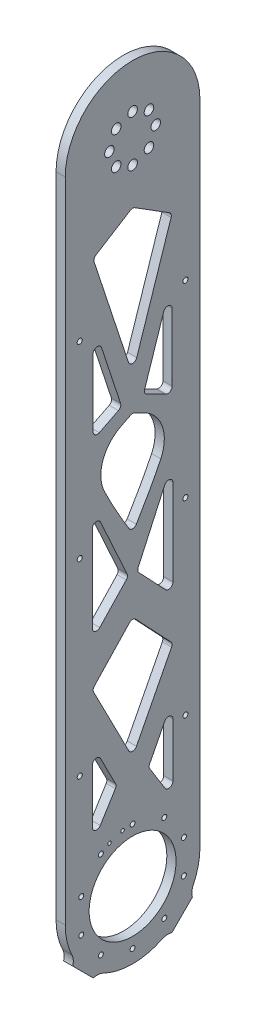
from build123d import *

# Parameters (mm, degrees)
SKETCH1_R                            = 3.3
SKETCH1_R_2                          = 1.7
SKETCH1_R_3                          = 26
BOSS_EXTRUDE1_DEPTH                  = 6.35
CUT_EXTRUDE1_DEPTH                   = 549.511460682
FILLET1_R                            = 3
SKETCH4_R                            = 1.75
CUT_EXTRUDE2_DEPTH                   = 549.511460792
SKETCH5_R                            = 1.2
CUT_EXTRUDE4_DEPTH                   = 549.511460792
BOSS_EXTRUDE2_START                  = -6.35
BOSS_EXTRUDE2_DEPTH                  = 6.35
TAP_DRILL_FOR_M3X0_5_TAP1_AT_2_COUNT = 2
TAP_DRILL_FOR_M3X0_5_TAP1_AT_2_PITCH = 13.03070812
CIRPATTERN1_COUNT                    = 2
CIRPATTERN1_ANGLE                    = 90
CUT_EXTRUDE5_DEPTH                   = 549.511460792
SKETCH10_R                           = 30
CUT_EXTRUDE6_DEPTH                   = 549.511460792
SKETCH11_W                           = 93
SKETCH11_H                           = 52.717688801
CUT_EXTRUDE7_DEPTH                   = 549.511460792
BOSS_EXTRUDE3_DEPTH                  = 6.35
SKETCH13_R                           = 1.75
CUT_EXTRUDE8_DEPTH                   = 549.511460792
SKETCH14_R                           = 1.75
BOSS_EXTRUDE4_DEPTH                  = 6.35
BOSS_EXTRUDE5_DEPTH                  = 6.35
CIRPATTERN2_COUNT                    = 2
CIRPATTERN2_ANGLE                    = 90
FILLET2_R                            = 10


# Read off the part's stored shape, not the designer's step: M3x0.5 Tapped Hole1
with BuildPart() as part:
    # Sketch1 → Boss-Extrude1 (new body)
    with BuildSketch(Plane(origin=(0, 0, 0), x_dir=(0, -1, 0), z_dir=(1, 0, 0))):
        with BuildLine():
            Line((0, 46.5), (500, 46.5))
            ThreePointArc((500, 46.5), (546.5, 0), (500, -46.5))
            Line((500, -46.5), (0, -46.5))
            ThreePointArc((0, -46.5), (-46.5, 0), (0, 46.5))
        make_face()
        with Locations(Location((-16, 0, 0), (0, 0, 90))):
            Circle(SKETCH1_R, mode=Mode.SUBTRACT)
        with Locations(Location((-11.313708499, 11.313708499, 0), (0, 0, 90))):
            Circle(SKETCH1_R, mode=Mode.SUBTRACT)
        with Locations(Location((0, 16, 0), (0, 0, 90))):
            Circle(SKETCH1_R, mode=Mode.SUBTRACT)
        with Locations(Location((11.313708499, 11.313708499, 0), (0, 0, 90))):
            Circle(SKETCH1_R, mode=Mode.SUBTRACT)
        with Locations(Location((16, 0, 0), (0, 0, 90))):
            Circle(SKETCH1_R, mode=Mode.SUBTRACT)
        with Locations(Location((11.313708499, -11.313708499, 0), (0, 0, 90))):
            Circle(SKETCH1_R, mode=Mode.SUBTRACT)
        with Locations(Location((537.25, 0, 0), (0, 0, 90))):
            Circle(SKETCH1_R_2, mode=Mode.SUBTRACT)
        with Locations(Location((530.13588304, -21.895000648, 0), (0, 0, 90))):
            Circle(SKETCH1_R_2, mode=Mode.SUBTRACT)
        with Locations(Location((511.51088304, -35.426855232, 0), (0, 0, 90))):
            Circle(SKETCH1_R_2, mode=Mode.SUBTRACT)
        with Locations(Location((488.48911696, -35.426855232, 0), (0, 0, 90))):
            Circle(SKETCH1_R_2, mode=Mode.SUBTRACT)
        with Locations(Location((469.86411696, -21.895000648, 0), (0, 0, 90))):
            Circle(SKETCH1_R_2, mode=Mode.SUBTRACT)
        with Locations(Location((462.75, 0, 0), (0, 0, 90))):
            Circle(SKETCH1_R_2, mode=Mode.SUBTRACT)
        with Locations(Location((469.86411696, 21.895000648, 0), (0, 0, 90))):
            Circle(SKETCH1_R_2, mode=Mode.SUBTRACT)
        with Locations(Location((488.48911696, 35.426855232, 0), (0, 0, 90))):
            Circle(SKETCH1_R_2, mode=Mode.SUBTRACT)
        with Locations(Location((511.51088304, 35.426855232, 0), (0, 0, 90))):
            Circle(SKETCH1_R_2, mode=Mode.SUBTRACT)
        with Locations(Location((530.13588304, 21.895000648, 0), (0, 0, 90))):
            Circle(SKETCH1_R_2, mode=Mode.SUBTRACT)
        with Locations(Location((500, 0, 0), (0, 0, 90))):
            Circle(SKETCH1_R_3, mode=Mode.SUBTRACT)
        with Locations(Location((0, -16, 0), (0, 0, 90))):
            Circle(SKETCH1_R, mode=Mode.SUBTRACT)
        with Locations(Location((-11.313708499, -11.313708499, 0), (0, 0, 90))):
            Circle(SKETCH1_R, mode=Mode.SUBTRACT)
    extrude(amount=BOSS_EXTRUDE1_DEPTH)

    # Sketch3 → Cut-Extrude1 (cut, through all)
    with BuildSketch(Plane(origin=(6.35, 0, 0), x_dir=(0, 0, -1), z_dir=(1, 0, 0))):
        Polygon((0, -422.848022722), (27.858212922, -368.632839363), (0, -339.139268075), (-27.858212922, -368.632839363), align=None)
        Polygon((0, -41.368651369), (-27.312924288, -58.435222232), (0, -141.248998295), (27.312924288, -58.435222232), align=None)
        Polygon((3, -313.189087212), (27.858212922, -339.506549748), (27.858212922, -258.646044282), align=None)
        Polygon((-27.858212922, -339.506549748), (-27.858212922, -258.646044282), (-3, -313.189087212), align=None)
        Polygon((-27.858212922, -401.452857349), (-11, -434.260816252), (-27.858212922, -461.481824785), align=None)
        Polygon((11, -434.260816252), (27.858212922, -461.481824785), (27.858212922, -401.452857349), align=None)
        with BuildLine():
            Line((0, -164.248853344), (-27.858212922, -178.200474573))
            add(Edge.make_bspline(
                [(-27.858212922, -178.200474573), (-43.7790539, -216.093343216), (-18.61661693, -258.276071598), (0, -289.085024731)],
                knots=[0, 0, 0, 0, 1, 1, 1, 1], degree=3))
            add(Edge.make_bspline(
                [(27.858212922, -178.200474573), (43.7790539, -216.093343216), (18.61661693, -258.276071598), (0, -289.085024731)],
                knots=[0, 0, 0, 0, 1, 1, 1, 1], degree=3))
            Line((27.858212922, -178.200474573), (0, -164.248853344))
        make_face()
        Polygon((7.5, -156.820958214), (27.312924288, -96.747453897), (27.312924288, -166.743432993), align=None)
        Polygon((-27.312924288, -96.747453897), (-27.312924288, -166.743432993), (-7.5, -156.820958214), align=None)
    extrude(amount=-CUT_EXTRUDE1_DEPTH, mode=Mode.SUBTRACT)

    # Fillet1
    fillet1_edges = [part.edges().sort_by_distance(p)[0] for p in [
        (3.175, -58.435222232, -27.312924288),
        (3.175, -41.368651369, 0),
        (3.175, -58.435222232, 27.312924288),
        (3.175, -141.248998295, 0),
        (3.175, -289.085024731, 0),
        (3.175, -164.248853344, 0),
        (3.175, -401.452857349, 27.858212922),
        (3.175, -434.260816252, 11),
        (3.175, -461.481824785, 27.858212922),
        (3.175, -461.481824785, -27.858212922),
        (3.175, -434.260816252, -11),
        (3.175, -401.452857349, -27.858212922),
        (3.175, -368.632839363, -27.858212922),
        (3.175, -339.139268075, 0),
        (3.175, -368.632839363, 27.858212922),
        (3.175, -422.848022722, 0),
        (3.175, -313.189087212, 3),
        (3.175, -339.506549748, 27.858212922),
        (3.175, -258.646044282, 27.858212922),
        (3.175, -178.200474573, -27.858212922),
        (3.175, -178.200474573, 27.858212922),
        (3.175, -339.506549748, -27.858212922),
        (3.175, -313.189087212, -3),
        (3.175, -258.646044282, -27.858212922),
        (3.175, -96.747453897, 27.312924288),
        (3.175, -166.743432993, 27.312924288),
        (3.175, -156.820958214, 7.5),
        (3.175, -166.743432993, -27.312924288),
        (3.175, -156.820958214, -7.5),
        (3.175, -96.747453897, -27.312924288),
    ]]
    fillet(fillet1_edges, radius=FILLET1_R)

    # Sketch4 → Cut-Extrude2 (cut, through all)
    with BuildSketch(Plane(origin=(6.35, 0, 0), x_dir=(0, 0, -1), z_dir=(1, 0, 0))):
        with Locations((-36.5, -103.175)):
            Circle(SKETCH4_R)
        with Locations(Location((36.5, -103.175, 0), (0, 0, 180))):
            Circle(SKETCH4_R)
        with Locations(Location((-36.5, -259.525, 0), (0, 0, 180))):
            Circle(SKETCH4_R)
        with Locations((36.5, -259.525)):
            Circle(SKETCH4_R)
        with Locations((-36.5, -415.875)):
            Circle(SKETCH4_R)
        with Locations(Location((36.5, -415.875, 0), (0, 0, 180))):
            Circle(SKETCH4_R)
    extrude(amount=-CUT_EXTRUDE2_DEPTH, mode=Mode.SUBTRACT)

    # Sketch5 → Cut-Extrude4 (cut, through all)
    with BuildSketch(Plane(origin=(6.35, 0, 0), x_dir=(0, 0, -1), z_dir=(1, 0, 0))):
        with Locations((-6.916110339, -463.343078174)):
            Circle(SKETCH5_R)
        with Locations((-15.951147244, -466.27873962)):
            Circle(SKETCH5_R)
    extrude(amount=-CUT_EXTRUDE4_DEPTH, mode=Mode.SUBTRACT)

    # Sketch6 → Boss-Extrude2 (add)
    with BuildSketch(Plane(origin=(6.35, 0, 0), x_dir=(0, 0, -1), z_dir=(1, 0, 0)).offset(BOSS_EXTRUDE2_START)):
        with BuildLine():
            Line((-44.110383395, -529.968247771), (-29.968247771, -544.110383395))
            ThreePointArc((-29.968247771, -544.110383395), (-23.286397782, -542.399293624), (-16.474718596, -543.483717035))
            ThreePointArc((-16.474718596, -543.483717035), (-32.880465325, -532.880465325), (-43.483717035, -516.474718596))
            ThreePointArc((-43.483717035, -516.474718596), (-42.399293624, -523.286397782), (-44.110383395, -529.968247771))
        make_face()
    boss_extrude2 = extrude(amount=BOSS_EXTRUDE2_DEPTH)

    # Sketch8 → Tap Drill for M3x0.5 Tap1 (revolve, cut)
    with BuildSketch(Plane(origin=(3.175, -532.796674896, 41.28195627), x_dir=(0, -0.7071067811865424, -0.7071067811865527), z_dir=(1, 0, 0))):
        Polygon((0, 0), (0, 5.751075774), (1.25, 5), (1.25, 0), align=None)
    tap_drill_for_m3x0_5_tap1 = revolve(axis=Axis((3.175, -537.286802956, 45.772084331), (0, 0.7071067811865529, -0.7071067811865422)), mode=Mode.SUBTRACT)

    # Tap Drill for M3x0.5 Tap1 at 2: Tap Drill for M3x0.5 Tap1 ×2
    with Locations(*[Vector(0, -0.7071067811865422, -0.7071067811865529) * (i * TAP_DRILL_FOR_M3X0_5_TAP1_AT_2_PITCH) for i in range(1, TAP_DRILL_FOR_M3X0_5_TAP1_AT_2_COUNT)]):
        add(tap_drill_for_m3x0_5_tap1, mode=Mode.SUBTRACT)

    # CirPattern1: Boss-Extrude2, Tap Drill for M3x0.5 Tap1 ×2 about axis
    cirpattern1_axis = Axis((0, -500, 0), (1, 0, 0))
    add([boss_extrude2.rotate(cirpattern1_axis, i * CIRPATTERN1_ANGLE / (CIRPATTERN1_COUNT - 1)) for i in range(1, CIRPATTERN1_COUNT)])
    add([tap_drill_for_m3x0_5_tap1.rotate(cirpattern1_axis, i * CIRPATTERN1_ANGLE / (CIRPATTERN1_COUNT - 1)) for i in range(1, CIRPATTERN1_COUNT)], mode=Mode.SUBTRACT)

    # CirPattern1 copy 1 sketch → CirPattern1 copy 1 (revolve, cut)
    with BuildSketch(Plane(origin=(3.175, -532.067854195, -42.010776971), x_dir=(0, 0.7071067811865551, -0.7071067811865399), z_dir=(1, 0, 0))):
        Polygon((0, 0), (0, 5.751075774), (1.25, 5), (1.25, 0), align=None)
    revolve(axis=Axis((3.175, -536.557982255, -46.500905032), (0, 0.7071067811865398, 0.7071067811865553)), mode=Mode.SUBTRACT)

    # Sketch9 → Cut-Extrude5 (cut, through all)
    with BuildSketch(Plane(origin=(6.35, 0, 0), x_dir=(0, 0, -1), z_dir=(1, 0, 0))):
        with BuildLine():
            Line((-43.483717035, -516.474718596), (-63.483717035, -516.474718596))
            ThreePointArc((-63.483717035, -516.474718596), (0, -565.586573942), (63.483717035, -516.474718596))
            Line((63.483717035, -516.474718596), (43.483717035, -516.474718596))
            ThreePointArc((43.483717035, -516.474718596), (0, -546.5), (-43.483717035, -516.474718596))
        make_face()
    extrude(amount=-CUT_EXTRUDE5_DEPTH, mode=Mode.SUBTRACT)

    # Sketch10 → Cut-Extrude6 (cut, through all)
    with BuildSketch(Plane(origin=(6.35, 0, 0), x_dir=(0, 0, -1), z_dir=(1, 0, 0))):
        with Locations((0, -500)):
            Circle(SKETCH10_R)
    extrude(amount=-CUT_EXTRUDE6_DEPTH, mode=Mode.SUBTRACT)

    # Sketch11 → Cut-Extrude7 (cut, through all)
    with BuildSketch(Plane.ZY):
        with Locations((0, -205.625859872)):
            Rectangle(SKETCH11_W, SKETCH11_H)
    extrude(amount=-CUT_EXTRUDE7_DEPTH, mode=Mode.SUBTRACT)


with BuildPart() as cut_extrude7_piece_1:
    # of the separate pieces the step leaves, piece 1, a body of its own (cut_extrude7_pieces)
    add(part.part.solids().sort_by_distance((0, -500, 46.5))[0])


with BuildPart() as cut_extrude7_piece_2:
    # of the separate pieces the step leaves, piece 2, a body of its own (cut_extrude7_pieces)
    add(part.part.solids().sort_by_distance((0, -179.267015471, 46.5))[0])


with BuildPart() as cut_extrude7_piece_2_1:
    # Body-Move/Copy1: moved
    add(cut_extrude7_piece_2.part.moved(Location((0, -52.7176888, 0))))

    # Combine1: union Cut-Extrude7 piece 1
    add(cut_extrude7_piece_1.part)

    # Sketch12 → Boss-Extrude3 (add)
    with BuildSketch(Plane.ZY):
        with BuildLine():
            Line((-8.107077378, -221.026632904), (-26.8521577, -230.414322677))
            ThreePointArc((-26.8521577, -230.414322677), (-27.717865763, -231.066969848), (-28.295067899, -231.984704273))
            add(Edge.make_bspline(
                [(-19.477332048, -254.141993575), (-22.908456866, -246.947780666), (-25.966776611, -239.522857913), (-28.295067899, -231.984704273)],
                knots=[0.341715687, 0.341715687, 0.341715687, 0.341715687, 0.53746001, 0.53746001, 0.53746001, 0.53746001], degree=3))
            ThreePointArc((-19.477332048, -254.141993575), (-20.557337263, -235.261485452), (-8.107077378, -221.026632904))
        make_face()
        with BuildLine():
            Line((8.107077378, -221.026632904), (26.8521577, -230.414322677))
            ThreePointArc((26.8521577, -230.414322677), (27.717865763, -231.066969847), (28.295067899, -231.984704271))
            add(Edge.make_bspline(
                [(28.295067899, -231.984704271), (25.966776612, -239.522857912), (22.908456866, -246.947780666), (19.477332048, -254.141993575)],
                knots=[0.46253999, 0.46253999, 0.46253999, 0.46253999, 0.658284313, 0.658284313, 0.658284313, 0.658284313], degree=3))
            ThreePointArc((19.477332048, -254.141993575), (20.557337263, -235.261485452), (8.107077378, -221.026632904))
        make_face()
    extrude(amount=-BOSS_EXTRUDE3_DEPTH)

    # Sketch13 → Cut-Extrude8 (cut, through all)
    with BuildSketch(Plane.ZY):
        with Locations((-36.5, -285.8838444)):
            Circle(SKETCH13_R)
        with Locations((36.5, -285.8838444)):
            Circle(SKETCH13_R)
    extrude(amount=-CUT_EXTRUDE8_DEPTH, mode=Mode.SUBTRACT)

    # Sketch14 → Boss-Extrude4 (add)
    with BuildSketch(Plane(origin=(6.35, 0, 0), x_dir=(0, 0, -1), z_dir=(1, 0, 0))):
        with Locations((36.5, -259.525)):
            Circle(SKETCH14_R)
        with Locations((-36.5, -259.525)):
            Circle(SKETCH14_R)
    extrude(amount=-BOSS_EXTRUDE4_DEPTH)

    # Sketch15 → Boss-Extrude5 (add)
    with BuildSketch(Plane.ZY):
        Polygon((-27.161387672, -541.303523296), (-25.040067328, -539.182202952), (-39.182202952, -525.040067328), (-41.303523296, -527.161387672), align=None)
        Polygon((27.161387672, -541.303523296), (41.303523296, -527.161387672), (39.182202952, -525.040067328), (25.040067328, -539.182202952), align=None)
    extrude(amount=-BOSS_EXTRUDE5_DEPTH)

    # M3x0.5 Tapped Hole1 outline → M3x0.5 Tapped Hole1 (revolve, cut)
    with BuildSketch(Plane(origin=(3.175, -245.580582618, 245.580582618), x_dir=(1, 0, 0), z_dir=(0, -0.7071067811865476, 0.7071067811865476))):
        Polygon((1.25, -394.465393412), (0, -393.714317638), (0, -401.965393412), (1.25, -401.965393412), align=None)
    m3x0_5_tapped_hole1 = revolve(axis=Axis((3.175, -245.580582618, 245.580582618), (0, 0.7071067811865476, 0.7071067811865476)), mode=Mode.SUBTRACT)

    # M3x0.5 Tapped Hole1 2 outline → M3x0.5 Tapped Hole1 2 (revolve, cut)
    with BuildSketch(Plane(origin=(3.175, -254.419417382, 254.419417382), x_dir=(1, 0, 0), z_dir=(0, -0.7071067811865476, 0.7071067811865476))):
        Polygon((1.25, -394.465393412), (0, -393.714317638), (0, -401.965393412), (1.25, -401.965393412), align=None)
    m3x0_5_tapped_hole1_2 = revolve(axis=Axis((3.175, -254.419417382, 254.419417382), (0, 0.7071067811865476, 0.7071067811865476)), mode=Mode.SUBTRACT)

    # CirPattern2: M3x0.5 Tapped Hole1, M3x0.5 Tapped Hole1 2 ×2 about axis
    cirpattern2_axis = Axis((0, -500, 0), (-1, 0, 0))
    add([m3x0_5_tapped_hole1.rotate(cirpattern2_axis, i * CIRPATTERN2_ANGLE / (CIRPATTERN2_COUNT - 1)) for i in range(1, CIRPATTERN2_COUNT)], mode=Mode.SUBTRACT)
    add([m3x0_5_tapped_hole1_2.rotate(cirpattern2_axis, i * CIRPATTERN2_ANGLE / (CIRPATTERN2_COUNT - 1)) for i in range(1, CIRPATTERN2_COUNT)], mode=Mode.SUBTRACT)

    # Fillet2
    # the kernel refuses this fillet: 10 mm, written as the material it adds along each edge
    with BuildSketch(Plane(origin=(0, -539.182202952, -25.040067328), x_dir=(0, -0.7071067811865345, -0.7071067811865606), z_dir=(1, 0, 0)), Plane(origin=(0, -525.040067328, 39.182202952), x_dir=(0, -0.7071067811865546, 0.7071067811865404), z_dir=(1, 0, 0))) as fillet2_piece_1:
        with BuildLine():
            CenterArc((7.897030706, -8.71889272), FILLET2_R, 119.321067137, 41.330757835)
            Line((-1.538196466, -5.405814363), (-1.72690101, -5.339552795))
            ThreePointArc((-1.72690101, -5.339552795), (-0.879713349, -2.671432223), (-0.195320442, 0.043010753))
            Line((-0.195320442, 0.043010753), (0, 0.2))
            ThreePointArc((0, 0.2), (1.5, 0.2), (2.902059386, 0.174377854))
            Line((2.902059386, 0.174377854), (3, 0))
        make_face()
    extrude(amount=6.35)
    with BuildSketch(Plane(origin=(0, -525.040067328, -39.182202952), x_dir=(0, 0.8736315230708372, -0.4865880823622061), z_dir=(1, 0, 0)), Plane(origin=(0, -539.182202952, 25.040067328), x_dir=(0, -0.4865880823622095, -0.8736315230708354), z_dir=(1, 0, 0))) as fillet2_piece_2:
        with BuildLine():
            CenterArc((6.224742227, -9.981721717), FILLET2_R, 93.464746761, 41.330757835)
            Line((-0.821043125, -2.885461521), (-0.961958832, -2.743536317))
            ThreePointArc((-0.961958832, -2.743536317), (-0.602885664, -1.387994552), (-0.192364101, 0.054736208))
            Line((-0.192364101, 0.054736208), (0.012086878, 0.199634434))
            ThreePointArc((0.012086878, 0.199634434), (2.810199161, 0.115005986), (5.608311443, 0.199634434))
            Line((5.608311443, 0.199634434), (5.620398321, 0))
        make_face()
    extrude(amount=6.35)


solid = cut_extrude7_piece_2_1.part
